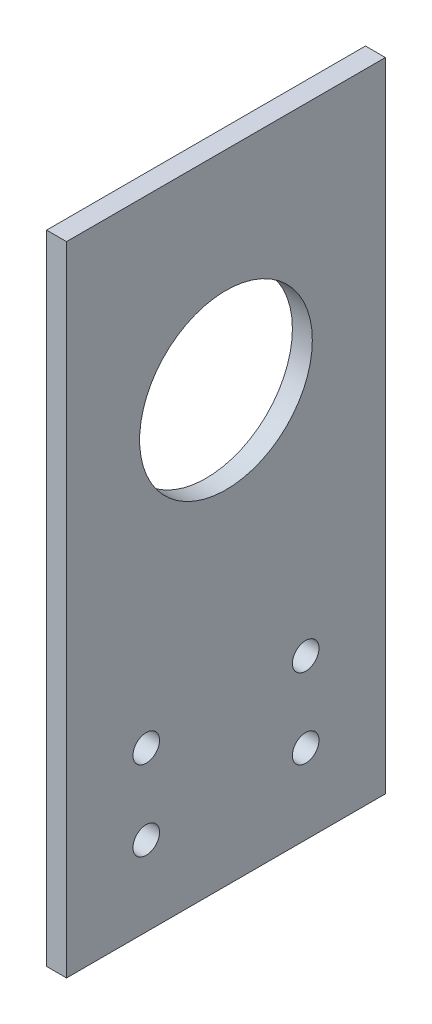
from build123d import *

# Parameters (mm, degrees)
SKETCH1_W           = 76.2
SKETCH1_H           = 152.4
BOSS_EXTRUDE1_DEPTH = 4.7625
CUT_EXTRUDE1_REACH  = 87.327
SKETCH2_R           = 20.6375
CUT_EXTRUDE2_REACH  = 87.327
SKETCH4_R           = 3.175


with BuildPart() as part:
    # Sketch1 → Boss-Extrude1 (new body)
    with BuildSketch(Plane(origin=(0, 0, 0), x_dir=(0, 0, -1), z_dir=(1, 0, 0))):
        Rectangle(SKETCH1_W, SKETCH1_H)
    extrude(amount=BOSS_EXTRUDE1_DEPTH)

    # Sketch2 → Cut-Extrude1 (cut, up to next)
    with BuildSketch(Plane(origin=(4.7625, 0, 0), x_dir=(0, 0, -1), z_dir=(1, 0, 0)), mode=Mode.PRIVATE) as cut_extrude1_sk1:
        with Locations((0, 26.416)):
            Circle(SKETCH2_R)
    cut_extrude1_tool1 = extrude(cut_extrude1_sk1.sketch, amount=-CUT_EXTRUDE1_REACH, mode=Mode.PRIVATE) & part.part
    add(cut_extrude1_tool1.solids().sort_by_distance((4.7625, 26.416, 0))[0], mode=Mode.SUBTRACT)

    # Sketch4 → Cut-Extrude2 (cut, up to next)
    with BuildSketch(Plane(origin=(4.7625, 0, 0), x_dir=(0, 0, -1), z_dir=(1, 0, 0)), mode=Mode.PRIVATE) as cut_extrude2_sk1:
        with Locations((-19.05, -38.1)):
            Circle(SKETCH4_R)
    cut_extrude2_tool1 = extrude(cut_extrude2_sk1.sketch, amount=-CUT_EXTRUDE2_REACH, mode=Mode.PRIVATE) & part.part
    # Sketch4 → Cut-Extrude2 (cut, up to next)
    with BuildSketch(Plane(origin=(4.7625, 0, 0), x_dir=(0, 0, -1), z_dir=(1, 0, 0)), mode=Mode.PRIVATE) as cut_extrude2_sk2:
        with Locations((19.05, -38.1)):
            Circle(SKETCH4_R)
    cut_extrude2_tool2 = extrude(cut_extrude2_sk2.sketch, amount=-CUT_EXTRUDE2_REACH, mode=Mode.PRIVATE) & part.part
    # Sketch4 → Cut-Extrude2 (cut, up to next)
    with BuildSketch(Plane(origin=(4.7625, 0, 0), x_dir=(0, 0, -1), z_dir=(1, 0, 0)), mode=Mode.PRIVATE) as cut_extrude2_sk3:
        with Locations((19.05, -57.15)):
            Circle(SKETCH4_R)
    cut_extrude2_tool3 = extrude(cut_extrude2_sk3.sketch, amount=-CUT_EXTRUDE2_REACH, mode=Mode.PRIVATE) & part.part
    # Sketch4 → Cut-Extrude2 (cut, up to next)
    with BuildSketch(Plane(origin=(4.7625, 0, 0), x_dir=(0, 0, -1), z_dir=(1, 0, 0)), mode=Mode.PRIVATE) as cut_extrude2_sk4:
        with Locations((-19.05, -57.15)):
            Circle(SKETCH4_R)
    cut_extrude2_tool4 = extrude(cut_extrude2_sk4.sketch, amount=-CUT_EXTRUDE2_REACH, mode=Mode.PRIVATE) & part.part
    add(cut_extrude2_tool1.solids().sort_by_distance((4.7625, -38.1, 19.05))[0], mode=Mode.SUBTRACT)
    add(cut_extrude2_tool2.solids().sort_by_distance((4.7625, -38.1, -19.05))[0], mode=Mode.SUBTRACT)
    add(cut_extrude2_tool3.solids().sort_by_distance((4.7625, -57.15, -19.05))[0], mode=Mode.SUBTRACT)
    add(cut_extrude2_tool4.solids().sort_by_distance((4.7625, -57.15, 19.05))[0], mode=Mode.SUBTRACT)


solid = part.part
